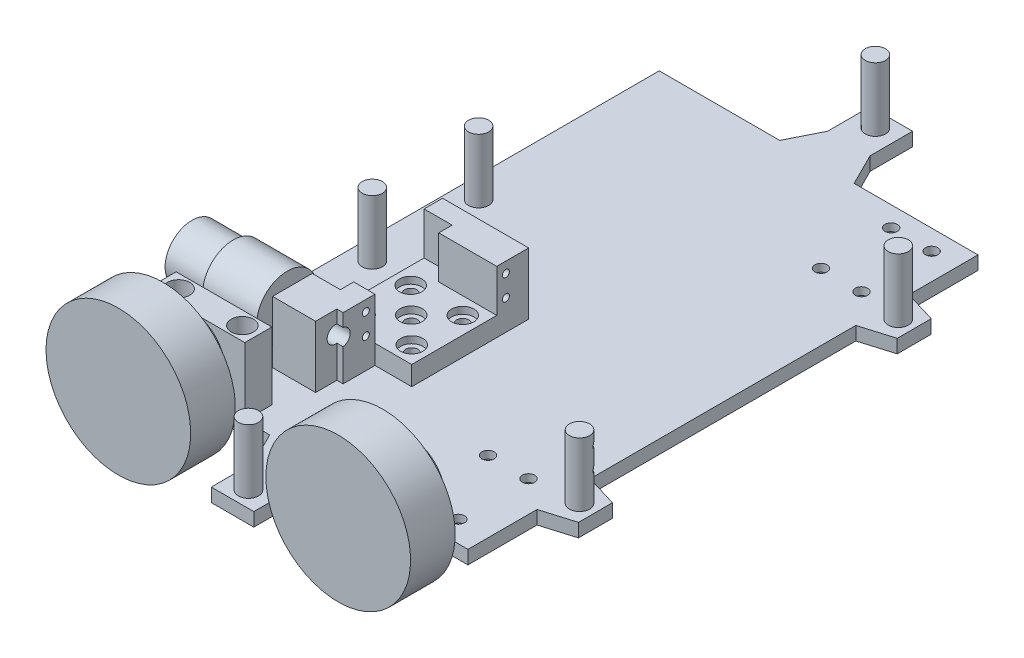
from build123d import *

# Parameters (mm, degrees)
BOSS_EXTRUDE1_START             = -19.05
SKETCH3_W                       = 150
SKETCH3_H                       = 240
BOSS_EXTRUDE1_DEPTH             = 6.35
CBORE_FOR_M5_SBHCS1_D           = 5.8
CBORE_FOR_M5_SBHCS1_CBORE_D     = 10.5
CBORE_FOR_M5_SBHCS1_CBORE_DEPTH = 2.75
BOSS_EXTRUDE2_START             = -19.05
SKETCH3_4_W                     = 45
SKETCH3_4_H                     = 12.7
BOSS_EXTRUDE2_DEPTH             = 31.75
CBORE_FOR_M5_SBHCS2_AT_2_COUNT  = 2
CBORE_FOR_M5_SBHCS2_AT_2_PITCH  = 30
SKETCH10_W                      = 3.96875
SKETCH10_H                      = 240
BOSS_EXTRUDE3_START             = -19.05
BOSS_EXTRUDE3_DEPTH             = 6.35
SKETCH3_5_W                     = 16.25
SKETCH3_5_H                     = 13
SKETCH3_6_W                     = 16.25
SKETCH3_6_H                     = 13
BOSS_EXTRUDE4_START             = 10.95
SKETCH13_4_R                    = 4.7625
BOSS_EXTRUDE4_DEPTH             = 30
BOSS_EXTRUDE4_2_DEPTH           = 30
BOSS_EXTRUDE4_3_DEPTH           = 30
BOSS_EXTRUDE4_4_DEPTH           = 30
BOSS_EXTRUDE4_5_DEPTH           = 30
BOSS_EXTRUDE4_6_DEPTH           = 30
SKETCH17_W                      = 19.353955523
SKETCH17_H                      = 12.715048465
BOSS_EXTRUDE5_START             = -19.05
SKETCH18_W                      = 4.2
SKETCH18_H                      = 6
BOSS_EXTRUDE5_DEPTH             = 9.05
BOSS_EXTRUDE6_START             = -19.05
SKETCH18_4_W                    = 10
SKETCH18_4_H                    = 10
SKETCH18_4_W_2                  = 4.2
SKETCH18_4_H_2                  = 4
BOSS_EXTRUDE6_DEPTH             = 29.05
CBORE_FOR_M5_SBHCS3_AT_2_COUNT  = 2
CBORE_FOR_M5_SBHCS3_AT_2_PITCH  = 24.5
CBORE_FOR_M5_SBHCS3_AT_3_COUNT  = 2
CBORE_FOR_M5_SBHCS3_AT_3_PITCH  = 34.296501279
CBORE_FOR_M5_SBHCS3_AT_4_COUNT  = 2
CBORE_FOR_M5_SBHCS3_AT_4_PITCH  = 24
CBORE_FOR_M5_SBHCS3_AT_5_COUNT  = 2
CBORE_FOR_M5_SBHCS3_AT_5_PITCH  = 17.14825064
CUT_EXTRUDE1_START              = -45
SKETCH22_W                      = 7
SKETCH22_H                      = 20
CUT_EXTRUDE1_DEPTH              = 13.2
BOSS_EXTRUDE7_START             = 10
SKETCH18_5_W                    = 20.25
SKETCH18_5_H                    = 10
BOSS_EXTRUDE7_DEPTH             = 29.05
SKETCH26_W                      = 1.65
SKETCH26_H                      = 121.8
M4X0_7_TAPPED_HOLE1_AT_2_COUNT  = 2
M4X0_7_TAPPED_HOLE1_AT_2_PITCH  = 9.9
M4X0_7_TAPPED_HOLE1_AT_3_COUNT  = 2
M4X0_7_TAPPED_HOLE1_AT_3_PITCH  = 49.59808464
M4X0_7_TAPPED_HOLE1_AT_4_COUNT  = 2
M4X0_7_TAPPED_HOLE1_AT_4_PITCH  = 48.6
SKETCH28_W                      = 3.96875
SKETCH28_H                      = 135
CUT_EXTRUDE2_START              = -45
SKETCH22_3_R                    = 6.35
CUT_EXTRUDE2_DEPTH              = 8


with BuildPart() as part:
    # Sketch3 → Boss-Extrude1 (new body)
    with BuildSketch(Plane(origin=(0, 0, 0), x_dir=(1, 0, 0), z_dir=(0, 1, 0)).offset(BOSS_EXTRUDE1_START)):
        Rectangle(SKETCH3_W, SKETCH3_H)
    extrude(amount=-BOSS_EXTRUDE1_DEPTH)

    # CBORE for M5 SBHCS1 (through all)
    with Locations(Plane.XZ.offset(25.4)):
        with Locations((60.475, 76.98), (41.425, 76.98), (41.425, 110), (60.475, 110), (62.618652823, -77.547885303), (43.568652823, -77.547885303), (62.618652823, -110.567885303), (43.568652823, -110.567885303)):
            CounterBoreHole(CBORE_FOR_M5_SBHCS1_D / 2, CBORE_FOR_M5_SBHCS1_CBORE_D / 2, CBORE_FOR_M5_SBHCS1_CBORE_DEPTH)

    # Sketch13 → Boss-Extrude3 (add)
    with BuildSketch(Plane(origin=(0, 0, 0), x_dir=(1, 0, 0), z_dir=(0, 1, 0)).offset(BOSS_EXTRUDE3_START)):
        Polygon((75, -87.5), (90, -83), (90, -67), (75, -62.5), align=None)
        Polygon((-18.275, -120), (-10.775, -135), (-10.775, -155), (9.225, -155), (9.225, -135), (16.725, -120), align=None)
        Polygon((75, 62.5), (75, 87.5), (90, 83), (90, 67), align=None)
        Polygon((-18.275, 120), (16.725, 120), (9.225, 135), (9.225, 155), (-10.775, 155), (-10.775, 135), align=None)
    extrude(amount=-BOSS_EXTRUDE3_DEPTH)


with BuildPart() as body_2:
    # Sketch3<4> → Boss-Extrude2 (new body)
    with BuildSketch(Plane(origin=(0, 0, 0), x_dir=(1, 0, 0), z_dir=(0, 1, 0)).offset(BOSS_EXTRUDE2_START)):
        with Locations((-52.5, -113.65)):
            Rectangle(SKETCH3_4_W, SKETCH3_4_H)
    extrude(amount=BOSS_EXTRUDE2_DEPTH)

    # Sketch8 → CBORE for M5 SBHCS2 (revolve, cut)
    with BuildSketch(Plane(origin=(-37.5, 12.7, 113.65), x_dir=(0, 0, 1), z_dir=(1, 0, 0))):
        Polygon((0, 0), (0, 38.1), (2.9, 38.1), (2.9, 12.75), (5.25, 12.75), (5.25, 0), align=None)
    cbore_for_m5_sbhcs2 = revolve(axis=Axis((-37.5, 19.05, 113.65), (0, -1, 0)), mode=Mode.SUBTRACT)

    # CBORE for M5 SBHCS2 at 2: CBORE for M5 SBHCS2 ×2
    with Locations(*[(-i * CBORE_FOR_M5_SBHCS2_AT_2_PITCH, 0, 0) for i in range(1, CBORE_FOR_M5_SBHCS2_AT_2_COUNT)]):
        add(cbore_for_m5_sbhcs2, mode=Mode.SUBTRACT)

    # Sketch10 → 3/8-16 Tapped Hole1 (revolve, cut)
    with BuildSketch(Plane(origin=(-52.5, 0, 120), x_dir=(0, -1, 0), z_dir=(1, 0, 0))):
        with Locations((1.984375, 120)):
            Rectangle(SKETCH10_W, SKETCH10_H)
    revolve(axis=Axis((-52.5, 0, 126.35), (0, 0, -1)), mode=Mode.SUBTRACT)

    # Sketch12 → 1/2 (0.5) Diameter Hole1 (revolve, cut)
    with BuildSketch(Plane(origin=(-52.5, 0, 120), x_dir=(0, -1, 0), z_dir=(1, 0, 0))):
        Polygon((0, 0), (0, 10.165464931), (6.35, 6.35), (6.35, 0), align=None)
    revolve(axis=Axis((-52.5, 0, 126.35), (0, 0, -1)), mode=Mode.SUBTRACT)


with BuildPart() as body_3:
    # Sketch3<5> → Revolve1 (revolve)
    with BuildSketch(Plane(origin=(0, 0, 0), x_dir=(1, 0, 0), z_dir=(0, 1, 0)), mode=Mode.PRIVATE) as revolve1_sk:
        with Locations((-60.625, -129.5)):
            Rectangle(SKETCH3_5_W, SKETCH3_5_H)
        Polygon((-68.75, -136), (-86.55, -136), (-86.55, -157), (-52.5, -157), (-52.5, -136), align=None)
    revolve(revolve1_sk.sketch.rotate(Axis((-52.5, 0, 123), (0, 0, 1)), 180), axis=Axis((-52.5, 0, 123), (0, 0, 1)))


with BuildPart() as body_4:
    # Sketch3<6> → Revolve2 (revolve)
    with BuildSketch(Plane(origin=(0, 0, 0), x_dir=(1, 0, 0), z_dir=(0, 1, 0))):
        with Locations((42.825, -129.5)):
            Rectangle(SKETCH3_6_W, SKETCH3_6_H)
        Polygon((34.7, -136), (16.9, -136), (16.9, -157), (50.95, -157), (50.95, -136), align=None)
    revolve(axis=Axis((50.95, 0, 123), (0, 0, 1)))


with BuildPart() as body_5:
    # Sketch13<4> → Boss-Extrude4 (new body)
    with BuildSketch(Plane(origin=(0, 0, 0), x_dir=(1, 0, 0), z_dir=(0, 1, 0)).offset(BOSS_EXTRUDE4_START)):
        with Locations(Location((82.5, -75, 0), (0, 0, 270))):
            Circle(SKETCH13_4_R)
    extrude(amount=-BOSS_EXTRUDE4_DEPTH)


with BuildPart() as body_6:
    # Sketch13<4> → Boss-Extrude4 2 (new body)
    with BuildSketch(Plane(origin=(0, 0, 0), x_dir=(1, 0, 0), z_dir=(0, 1, 0)).offset(BOSS_EXTRUDE4_START)):
        with Locations(Location((-65, -25, 0), (0, 0, 270))):
            Circle(SKETCH13_4_R)
    extrude(amount=-BOSS_EXTRUDE4_2_DEPTH)


with BuildPart() as body_7:
    # Sketch13<4> → Boss-Extrude4 3 (new body)
    with BuildSketch(Plane(origin=(0, 0, 0), x_dir=(1, 0, 0), z_dir=(0, 1, 0)).offset(BOSS_EXTRUDE4_START)):
        with Locations(Location((-65, 25, 0), (0, 0, 270))):
            Circle(SKETCH13_4_R)
    extrude(amount=-BOSS_EXTRUDE4_3_DEPTH)


with BuildPart() as body_8:
    # Sketch13<4> → Boss-Extrude4 4 (new body)
    with BuildSketch(Plane(origin=(0, 0, 0), x_dir=(1, 0, 0), z_dir=(0, 1, 0)).offset(BOSS_EXTRUDE4_START)):
        with Locations(Location((-0.775, -147.5, 0), (0, 0, 270))):
            Circle(SKETCH13_4_R)
    extrude(amount=-BOSS_EXTRUDE4_4_DEPTH)


with BuildPart() as body_9:
    # Sketch13<4> → Boss-Extrude4 5 (new body)
    with BuildSketch(Plane(origin=(0, 0, 0), x_dir=(1, 0, 0), z_dir=(0, 1, 0)).offset(BOSS_EXTRUDE4_START)):
        with Locations(Location((82.5, 75, 0), (0, 0, 270))):
            Circle(SKETCH13_4_R)
    extrude(amount=-BOSS_EXTRUDE4_5_DEPTH)


with BuildPart() as body_10:
    # Sketch13<4> → Boss-Extrude4 6 (new body)
    with BuildSketch(Plane(origin=(0, 0, 0), x_dir=(1, 0, 0), z_dir=(0, 1, 0)).offset(BOSS_EXTRUDE4_START)):
        with Locations(Location((-0.775, 147.5, 0), (0, 0, 270))):
            Circle(SKETCH13_4_R)
    extrude(amount=-BOSS_EXTRUDE4_6_DEPTH)


with BuildPart() as body_11:
    # Sketch17 → Revolve3 (revolve)
    with BuildSketch(Plane(origin=(0, 0, 0), x_dir=(1, 0, 0), z_dir=(0, 1, 0)), mode=Mode.PRIVATE) as revolve3_sk:
        with Locations((-82.576977762, -76.192475768)):
            Rectangle(SKETCH17_W, SKETCH17_H)
        Polygon((-47.5, -68.199), (-72.9, -68.199), (-72.9, -69.834951535), (-72.9, -82.55), (-47.5, -82.55), align=None)
    revolve(revolve3_sk.sketch.rotate(Axis((-72.9, 0, 82.55), (1, 0, 0)), 180), axis=Axis((-72.9, 0, 82.55), (1, 0, 0)))


with BuildPart() as body_12:
    # Sketch18 → Boss-Extrude5 (new body)
    with BuildSketch(Plane(origin=(0, 0, 0), x_dir=(1, 0, 0), z_dir=(0, 1, 0)).offset(BOSS_EXTRUDE5_START)):
        Polygon((-36, -26.95), (-45, -26.95), (-45, -66.95), (-36, -66.95), (-31.8, -66.95), (-21.8, -66.95), (-4.5, -66.95), (-4.5, -26.95), (-21.8, -26.95), (-31.8, -26.95), align=None)
        with Locations((-33.9, -69.95)):
            Rectangle(SKETCH18_W, SKETCH18_H)
        with Locations((-33.9, -23.95)):
            Rectangle(SKETCH18_W, SKETCH18_H)
    extrude(amount=BOSS_EXTRUDE5_DEPTH)

    # Sketch18<4> → Boss-Extrude6 (add)
    with BuildSketch(Plane(origin=(0, 0, 0), x_dir=(1, 0, 0), z_dir=(0, 1, 0)).offset(BOSS_EXTRUDE6_START)):
        Polygon((-36, -66.95), (-45, -66.95), (-45, -76.95), (-36, -76.95), (-36, -72.95), align=None)
        Polygon((-36, -76.95), (-45, -76.95), (-45, -81.95), (-24.75, -81.95), (-21.8, -81.95), (-21.8, -76.95), (-31.8, -76.95), align=None)
        with Locations((-26.8, -71.95)):
            Rectangle(SKETCH18_4_W, SKETCH18_4_H)
        Polygon((-45, -11.95), (-45, -16.95), (-36, -16.95), (-31.8, -16.95), (-21.8, -16.95), (-21.8, -26.95), (-4.5, -26.95), (-4.5, -11.95), align=None)
        Polygon((-45, -16.95), (-45, -26.95), (-36, -26.95), (-36, -20.95), (-36, -16.95), align=None)
        with Locations((-26.8, -21.95)):
            Rectangle(SKETCH18_4_W, SKETCH18_4_H)
        with Locations((-33.9, -74.95)):
            Rectangle(SKETCH18_4_W_2, SKETCH18_4_H_2)
        with Locations((-33.9, -18.95)):
            Rectangle(SKETCH18_4_W_2, SKETCH18_4_H_2)
    extrude(amount=BOSS_EXTRUDE6_DEPTH)

    # Sketch20 → CBORE for M5 SBHCS3 (revolve, cut)
    with BuildSketch(Plane(origin=(-12.5, -10, 34.95), x_dir=(0, 0, 1), z_dir=(1, 0, 0))):
        Polygon((0, 0), (0, 24.05), (2.9, 24.05), (2.9, 3.25), (5.25, 3.25), (5.25, 0), align=None)
    cbore_for_m5_sbhcs3 = revolve(axis=Axis((-12.5, -3.65, 34.95), (0, -1, 0)), mode=Mode.SUBTRACT)

    # CBORE for M5 SBHCS3 at 2: CBORE for M5 SBHCS3 ×2
    with Locations(*[(-i * CBORE_FOR_M5_SBHCS3_AT_2_PITCH, 0, 0) for i in range(1, CBORE_FOR_M5_SBHCS3_AT_2_COUNT)]):
        add(cbore_for_m5_sbhcs3, mode=Mode.SUBTRACT)

    # CBORE for M5 SBHCS3 at 3: CBORE for M5 SBHCS3 ×2
    with Locations(*[Vector(-0.714358581375119, 0, 0.6997798348164426) * (i * CBORE_FOR_M5_SBHCS3_AT_3_PITCH) for i in range(1, CBORE_FOR_M5_SBHCS3_AT_3_COUNT)]):
        add(cbore_for_m5_sbhcs3, mode=Mode.SUBTRACT)

    # CBORE for M5 SBHCS3 at 4: CBORE for M5 SBHCS3 ×2
    with Locations(*[(0, 0, i * CBORE_FOR_M5_SBHCS3_AT_4_PITCH) for i in range(1, CBORE_FOR_M5_SBHCS3_AT_4_COUNT)]):
        add(cbore_for_m5_sbhcs3, mode=Mode.SUBTRACT)

    # CBORE for M5 SBHCS3 at 5: CBORE for M5 SBHCS3 ×2
    with Locations(*[Vector(-0.714358581375119, 0, 0.6997798348164425) * (i * CBORE_FOR_M5_SBHCS3_AT_5_PITCH) for i in range(1, CBORE_FOR_M5_SBHCS3_AT_5_COUNT)]):
        add(cbore_for_m5_sbhcs3, mode=Mode.SUBTRACT)

    # Sketch22 → Cut-Extrude1 (cut)
    with BuildSketch(Plane(origin=(0, 0, 0), x_dir=(0, 0, -1), z_dir=(1, 0, 0)).offset(CUT_EXTRUDE1_START)):
        with Locations((-69.75, 0)):
            Rectangle(SKETCH22_W, SKETCH22_H)
        with Locations((-24.15, 0)):
            Rectangle(SKETCH22_W, SKETCH22_H)
    extrude(amount=CUT_EXTRUDE1_DEPTH, mode=Mode.SUBTRACT)

    # Sketch18<5> → Boss-Extrude7 (add)
    with BuildSketch(Plane(origin=(0, 0, 0), x_dir=(1, 0, 0), z_dir=(0, 1, 0)).offset(BOSS_EXTRUDE7_START)):
        with Locations((-34.875, -86.95)):
            Rectangle(SKETCH18_5_W, SKETCH18_5_H)
    extrude(amount=-BOSS_EXTRUDE7_DEPTH)

    # Sketch26 → M4x0.7 Tapped Hole1 (revolve, cut)
    with BuildSketch(Plane(origin=(-31.8, 4.95, 22.65), x_dir=(0, 0, 1), z_dir=(0, 1, 0))):
        with Locations((0.825, 60.9)):
            Rectangle(SKETCH26_W, SKETCH26_H)
    m4x0_7_tapped_hole1 = revolve(axis=Axis((-38.15, 4.95, 22.65), (1, 0, 0)), mode=Mode.SUBTRACT)

    # M4x0.7 Tapped Hole1 at 2: M4x0.7 Tapped Hole1 ×2
    with Locations(*[(0, -i * M4X0_7_TAPPED_HOLE1_AT_2_PITCH, 0) for i in range(1, M4X0_7_TAPPED_HOLE1_AT_2_COUNT)]):
        add(m4x0_7_tapped_hole1, mode=Mode.SUBTRACT)


with BuildPart() as m4x0_7_tapped_hole1_at_3_tool:
    # M4x0.7 Tapped Hole1 at 3: M4x0.7 Tapped Hole1 ×2
    with Locations(*[Vector(0, -0.19960448214422571, 0.9798765487080173) * (i * M4X0_7_TAPPED_HOLE1_AT_3_PITCH) for i in range(1, M4X0_7_TAPPED_HOLE1_AT_3_COUNT)]):
        add(m4x0_7_tapped_hole1)


with BuildPart() as body_5_1:
    add(body_5.part)

    # M4x0.7 Tapped Hole1 at 3: cut by m4x0_7_tapped_hole1_at_3_tool
    add(m4x0_7_tapped_hole1_at_3_tool.part, mode=Mode.SUBTRACT)


with BuildPart() as body_12_1:
    add(body_12.part)

    # M4x0.7 Tapped Hole1 at 3: cut by m4x0_7_tapped_hole1_at_3_tool
    add(m4x0_7_tapped_hole1_at_3_tool.part, mode=Mode.SUBTRACT)


with BuildPart() as m4x0_7_tapped_hole1_at_4_tool:
    # M4x0.7 Tapped Hole1 at 4: M4x0.7 Tapped Hole1 ×2
    with Locations(*[(0, 0, i * M4X0_7_TAPPED_HOLE1_AT_4_PITCH) for i in range(1, M4X0_7_TAPPED_HOLE1_AT_4_COUNT)]):
        add(m4x0_7_tapped_hole1)


with BuildPart() as body_5_2:
    add(body_5_1.part)

    # M4x0.7 Tapped Hole1 at 4: cut by m4x0_7_tapped_hole1_at_4_tool
    add(m4x0_7_tapped_hole1_at_4_tool.part, mode=Mode.SUBTRACT)


with BuildPart() as body_12_2:
    add(body_12_1.part)

    # M4x0.7 Tapped Hole1 at 4: cut by m4x0_7_tapped_hole1_at_4_tool
    add(m4x0_7_tapped_hole1_at_4_tool.part, mode=Mode.SUBTRACT)

    # Sketch28 → 3/8-16 Tapped Hole2 (revolve, cut)
    with BuildSketch(Plane(origin=(-45, 0, 82.55), x_dir=(0, 0, 1), z_dir=(0, 1, 0))):
        with Locations((1.984375, 67.5)):
            Rectangle(SKETCH28_W, SKETCH28_H)
    revolve(axis=Axis((-51.35, 0, 82.55), (1, 0, 0)), mode=Mode.SUBTRACT)

    # Sketch22<3> → Cut-Extrude2 (cut)
    with BuildSketch(Plane(origin=(0, 0, 0), x_dir=(0, 0, -1), z_dir=(1, 0, 0)).offset(CUT_EXTRUDE2_START)):
        with Locations((-82.55, 0)):
            Circle(SKETCH22_3_R)
    extrude(amount=CUT_EXTRUDE2_DEPTH, mode=Mode.SUBTRACT)


solid = Compound([part.part, body_2.part, body_3.part, body_4.part, body_6.part, body_7.part, body_8.part, body_9.part, body_10.part, body_11.part, body_5_2.part, body_12_2.part])
